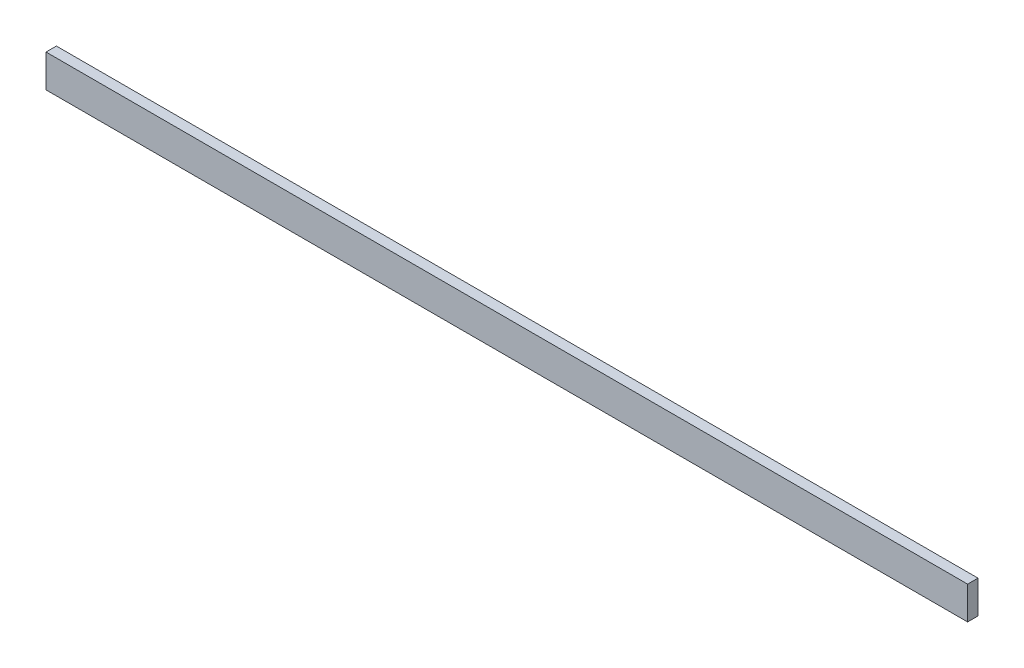
from build123d import *

# Parameters (mm, degrees)
SKETCH1_W           = 1686.8
SKETCH1_H           = 19
BOSS_EXTRUDE1_DEPTH = 60


with BuildPart() as part:
    # Sketch1 → Boss-Extrude1 (new body)
    with BuildSketch(Plane(origin=(0, 0, 0), x_dir=(1, 0, 0), z_dir=(0, 1, 0))):
        with Locations((843.4, 0)):
            Rectangle(SKETCH1_W, SKETCH1_H)
    extrude(amount=BOSS_EXTRUDE1_DEPTH)


solid = part.part
